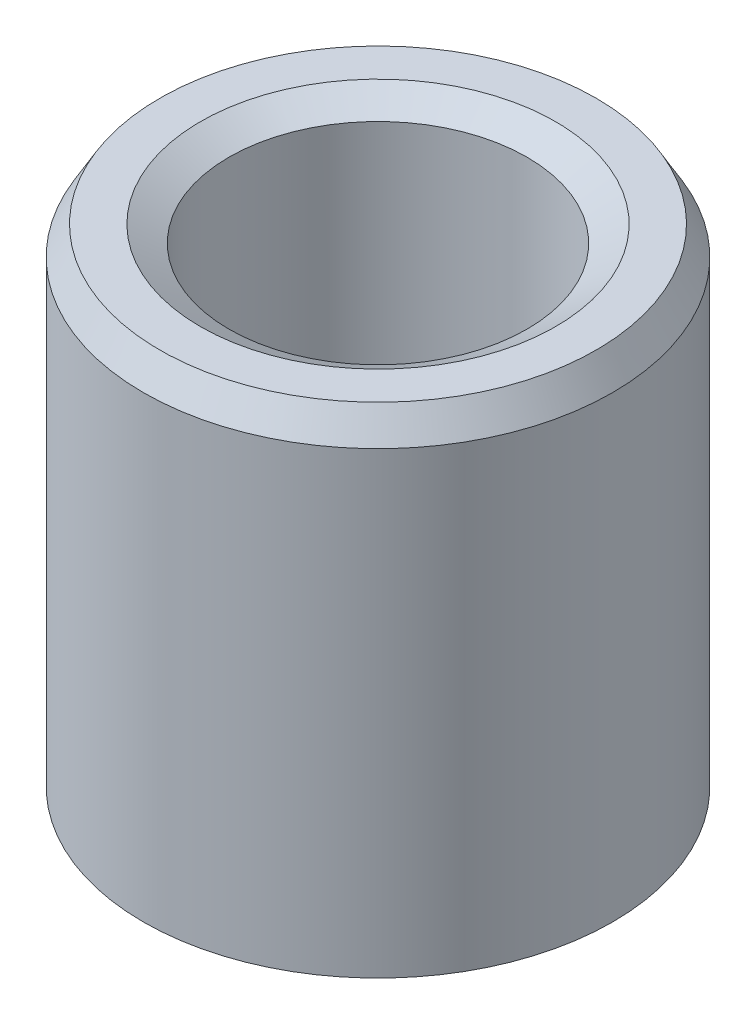
from build123d import *
from OCP.BRepFilletAPI import BRepFilletAPI_MakeChamfer

# Parameters (mm, degrees)
SKETCH1_R           = 7.5
BOSS_EXTRUDE1_DEPTH = 16.094240876
SKETCH2_R           = 4.762703504
CUT_EXTRUDE1_DEPTH  = 20.274973136
CHAMFER1_SIZE       = 0.91303791
CHAMFER1_SIZE2      = 0.527142683


with BuildPart() as part:
    # Sketch1 → Boss-Extrude1 (new body)
    with BuildSketch(Plane(origin=(0, 0, 0), x_dir=(1, 0, 0), z_dir=(0, 1, 0))):
        Circle(SKETCH1_R)
    extrude(amount=BOSS_EXTRUDE1_DEPTH)

    # Sketch2 → Cut-Extrude1 (cut, through all)
    with BuildSketch(Plane(origin=(0, 0, 0), x_dir=(1, 0, 0), z_dir=(0, 1, 0))):
        Circle(SKETCH2_R)
    extrude(amount=CUT_EXTRUDE1_DEPTH, mode=Mode.SUBTRACT)

    # Chamfer1: one chamfer whose edges measure the first distance from different faces: ONE call of the kernel's chamfer builder (chamfer() names one face for all edges)
    chamfer1_edges_1 = [part.edges().sort_by_distance(p)[0] for p in [
        (-4.762703504, 16.094240876, 0),
    ]]
    chamfer1_side_1 = [part.faces().sort_by_distance(p)[0] for p in [
        (-7.287867966, 16.094240876, 0),
    ]]
    chamfer1_edges_2 = [part.edges().sort_by_distance(p)[0] for p in [
        (-4.762703504, 0, 0),
    ]]
    chamfer1_side_2 = [part.faces().sort_by_distance(p)[0] for p in [
        (-4.762703504, 8.047120438, 0),
    ]]
    chamfer1_edges_3 = [part.edges().sort_by_distance(p)[0] for p in [
        (-7.5, 0, 0),
    ]]
    chamfer1_side_3 = [part.faces().sort_by_distance(p)[0] for p in [
        (-7.287867966, 0, 0),
    ]]
    chamfer1_edges_4 = [part.edges().sort_by_distance(p)[0] for p in [
        (-7.5, 16.094240876, 0),
    ]]
    chamfer1_side_4 = [part.faces().sort_by_distance(p)[0] for p in [
        (-7.5, 8.047120438, 0),
    ]]
    chamfer1 = BRepFilletAPI_MakeChamfer(part.part.solid().wrapped)
    for e in chamfer1_edges_1:
        chamfer1.Add(CHAMFER1_SIZE, CHAMFER1_SIZE2, e.wrapped, chamfer1_side_1[0].wrapped)  # the first distance lies on this face
    for e in chamfer1_edges_2:
        chamfer1.Add(CHAMFER1_SIZE, CHAMFER1_SIZE2, e.wrapped, chamfer1_side_2[0].wrapped)  # the first distance lies on this face
    for e in chamfer1_edges_3:
        chamfer1.Add(CHAMFER1_SIZE, CHAMFER1_SIZE2, e.wrapped, chamfer1_side_3[0].wrapped)  # the first distance lies on this face
    for e in chamfer1_edges_4:
        chamfer1.Add(CHAMFER1_SIZE, CHAMFER1_SIZE2, e.wrapped, chamfer1_side_4[0].wrapped)  # the first distance lies on this face
    add(Compound.cast(chamfer1.Shape()), mode=Mode.REPLACE)


solid = part.part
